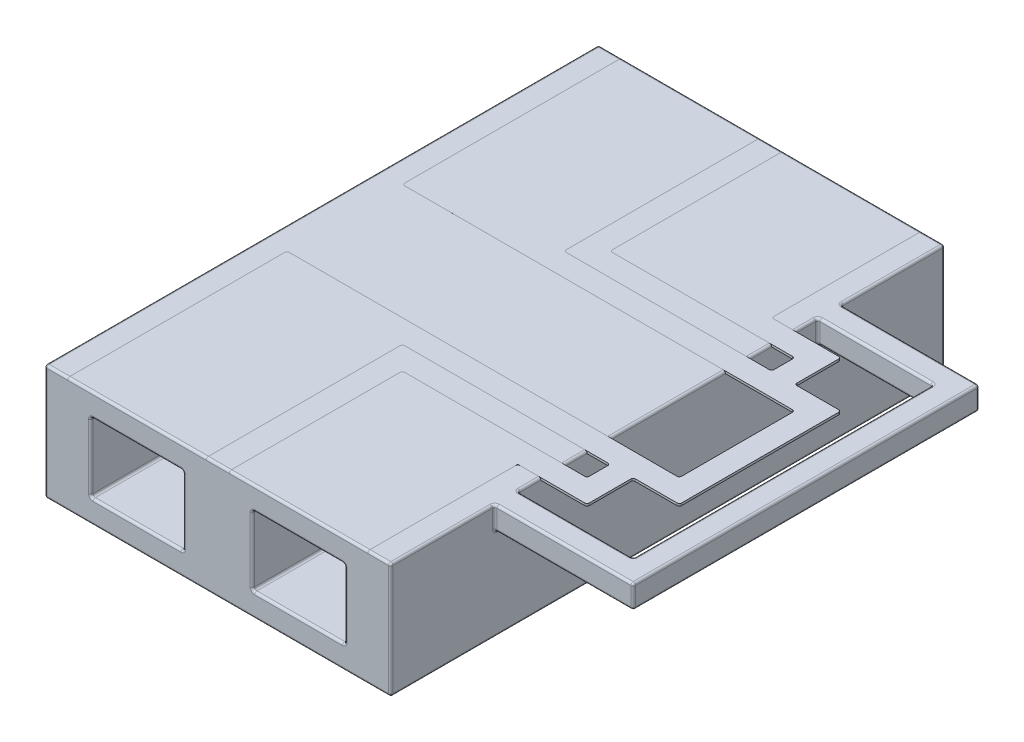
from build123d import *

# Parameters (mm, degrees)
SKETCH_SHROUD_SURFACES_W              = 5
SKETCH_SHROUD_SURFACES_H              = 13
SHROUD_SURFACES_DEPTH                 = 1
SKETCH_MOUNT_W                        = 15
SKETCH_MOUNT_H                        = 24
MOUNT_DEPTH                           = 4
BODY_FILLETS_R                        = 0.1
SPACE_FOR_CONDUCTIVE_TRACES_DEPTH     = 0.1
SPACE_FOR_CONDUCTIVE_TRACES_FILLETS_R = 0.1
CONDUCTIVE_TRACES_DEPTH               = 0.1
CONDUCTIVE_TRACES_FILLETS_R           = 0.1
ELECTRICAL_CONTACTS_FILLETS_R         = 0.1
CUT_EXTRUDE0_START                    = -1
SKETCH0_W                             = 4
SKETCH0_H                             = 5
CUT_EXTRUDE0_DEPTH                    = 3
FILLET0_R                             = 0.1


with BuildPart() as part:
    # Sketch: Shroud Surfaces → Shroud Surfaces (new body)
    with BuildSketch(Plane(origin=(0, 0, 0), x_dir=(1, 0, 0), z_dir=(0, 1, 0))):
        Polygon((15, 7.5), (21, 7.5), (21, -7.5), (15, -7.5), (15, -12), (0, -12), (0, 12), (15, 12), align=None)
        with Locations((17.5, 0)):
            Rectangle(SKETCH_SHROUD_SURFACES_W, SKETCH_SHROUD_SURFACES_H, mode=Mode.SUBTRACT)
    extrude(amount=-SHROUD_SURFACES_DEPTH)

    # Sketch: Mount → Mount (add)
    with BuildSketch(Plane.XZ.offset(1)):
        with Locations((7.5, 0)):
            Rectangle(SKETCH_MOUNT_W, SKETCH_MOUNT_H)
    extrude(amount=MOUNT_DEPTH)

    # Body Fillets
    body_fillets_edges = [part.edges().sort_by_distance(p)[0] for p in [
        (17.5, -1, 6.5),
        (15, 0, 9.75),
        (7.5, 0, 12),
        (0, 0, 0),
        (7.5, 0, -12),
        (15, 0, -9.75),
        (18, 0, -7.5),
        (21, 0, 0),
        (18, 0, 7.5),
        (17.5, 0, -6.5),
        (15, 0, 0),
        (17.5, 0, 6.5),
        (20, 0, 0),
        (17.5, -1, -6.5),
        (15, -0.5, 7.5),
        (15, -2.5, 12),
        (0, -2.5, 12),
        (0, -2.5, -12),
        (15, -2.5, -12),
        (15, -0.5, -7.5),
        (21, -0.5, -7.5),
        (21, -0.5, 7.5),
        (20, -0.5, -6.5),
        (15, -0.5, -6.5),
        (15, -0.5, 6.5),
        (20, -0.5, 6.5),
        (18, -1, 7.5),
        (21, -1, 0),
        (18, -1, -7.5),
        (15, -1, 7),
        (15, -1, -7),
        (0, -5, 0),
        (7.5, -5, -12),
        (15, -5, 0),
        (7.5, -5, 12),
        (20, -1, 0),
    ]]
    fillet(body_fillets_edges, radius=BODY_FILLETS_R)

    # Sketch: Conductive Traces → Space for Conductive Traces (cut)
    with BuildSketch(Plane(origin=(0, 0, 0), x_dir=(1, 0, 0), z_dir=(0, 1, 0))):
        Polygon((18, -2.5), (1, -2.5), (1, -12), (7, -12), (7, -3.5), (16, -3.5), (16, -4.5), (8, -4.5), (8, -12), (14, -12), (14, -5.5), (17, -5.5), (17, -3.5), (19, -3.5), (19, 3.5), (17, 3.5), (17, 5.5), (14, 5.5), (14, 12), (8, 12), (8, 4.5), (16, 4.5), (16, 3.5), (7, 3.5), (7, 12), (1, 12), (1, 2.5), (18, 2.5), align=None)
    extrude(amount=-SPACE_FOR_CONDUCTIVE_TRACES_DEPTH, mode=Mode.SUBTRACT)

    # Space for Conductive Traces Fillets
    space_for_conductive_traces_fillets_edges = [part.edges().sort_by_distance(p)[0] for p in [
        (7, -0.05, 3.5),
        (1, -0.05, 2.5),
        (1, -0.05, -2.5),
        (7, -0.05, -3.5),
        (8, -0.05, -4.5),
        (14, -0.05, -5.5),
        (14, -0.05, 5.5),
        (8, -0.05, 4.5),
    ]]
    fillet(space_for_conductive_traces_fillets_edges, radius=SPACE_FOR_CONDUCTIVE_TRACES_FILLETS_R)

    # Sketch0 → Cut-Extrude0 (cut)
    with BuildSketch(Plane(origin=(0, 0, 0), x_dir=(1, 0, 0), z_dir=(0, 1, 0)).offset(CUT_EXTRUDE0_START)):
        with Locations((4, 9.5)):
            Rectangle(SKETCH0_W, SKETCH0_H)
        with Locations((11, 9.5)):
            Rectangle(SKETCH0_W, SKETCH0_H)
        with Locations((11, -9.5)):
            Rectangle(SKETCH0_W, SKETCH0_H)
        with Locations((4, -9.5)):
            Rectangle(SKETCH0_W, SKETCH0_H)
    extrude(amount=-CUT_EXTRUDE0_DEPTH, mode=Mode.SUBTRACT)

    # Fillet0
    fillet0_edges = [part.edges().sort_by_distance(p)[0] for p in [
        (2, -4, 9.5),
        (2, -2.5, 12),
        (4, -4, 7),
        (2, -2.5, 7),
        (6, -4, 9.5),
        (6, -2.5, 7),
        (4, -4, 12),
        (6, -2.5, 12),
        (2, -1, 9.5),
        (4, -1, 12),
        (6, -1, 9.5),
        (4, -1, 7),
        (9, -4, 9.5),
        (9, -2.5, 12),
        (11, -4, 7),
        (9, -2.5, 7),
        (13, -4, 9.5),
        (13, -2.5, 7),
        (11, -4, 12),
        (13, -2.5, 12),
        (9, -1, 9.5),
        (11, -1, 12),
        (13, -1, 9.5),
        (11, -1, 7),
        (9, -4, -9.5),
        (9, -2.5, -7),
        (11, -4, -12),
        (9, -2.5, -12),
        (13, -4, -9.5),
        (13, -2.5, -12),
        (11, -4, -7),
        (13, -2.5, -7),
        (9, -1, -9.5),
        (11, -1, -7),
        (13, -1, -9.5),
        (11, -1, -12),
        (2, -4, -9.5),
        (2, -2.5, -7),
        (4, -4, -12),
        (2, -2.5, -12),
        (6, -4, -9.5),
        (6, -2.5, -12),
        (4, -4, -7),
        (6, -2.5, -7),
        (2, -1, -9.5),
        (4, -1, -7),
        (6, -1, -9.5),
        (4, -1, -12),
    ]]
    fillet(fillet0_edges, radius=FILLET0_R)


with BuildPart() as body_2:
    # Conductive Traces Sketch<5> → Conductive Traces (new body)
    with BuildSketch(Plane(origin=(0, 0, 0), x_dir=(1, 0, 0), z_dir=(0, 1, 0))):
        Polygon((18, -2.5), (1, -2.5), (1, -12), (7, -12), (7, -3.5), (16, -3.5), (16, -4.5), (8, -4.5), (8, -12), (14, -12), (14, -5.5), (17, -5.5), (17, -3.5), (19, -3.5), (19, 3.5), (17, 3.5), (17, 5.5), (14, 5.5), (14, 12), (8, 12), (8, 4.5), (16, 4.5), (16, 3.5), (7, 3.5), (7, 12), (1, 12), (1, 2.5), (18, 2.5), align=None)
    extrude(amount=-CONDUCTIVE_TRACES_DEPTH)

    # Conductive Traces Fillets
    conductive_traces_fillets_edges = [body_2.edges().sort_by_distance(p)[0] for p in [
        (7, -0.05, 3.5),
        (1, -0.05, 2.5),
        (18, -0.05, 2.5),
        (18, -0.05, -2.5),
        (1, -0.05, -2.5),
        (7, -0.05, -3.5),
        (16, -0.05, -3.5),
        (16, -0.05, -4.5),
        (8, -0.05, -4.5),
        (14, -0.05, -5.5),
        (17, -0.05, -5.5),
        (17, -0.05, -3.5),
        (19, -0.05, -3.5),
        (19, -0.05, 3.5),
        (17, -0.05, 3.5),
        (17, -0.05, 5.5),
        (8, -0.05, 4.5),
        (16, -0.05, 4.5),
        (16, -0.05, 3.5),
    ]]
    fillet(conductive_traces_fillets_edges, radius=CONDUCTIVE_TRACES_FILLETS_R)

    # Electrical Contacts Fillets
    electrical_contacts_fillets_edges = [body_2.edges().sort_by_distance(p)[0] for p in [
        (11, 0, -12),
        (4, 0, -12),
        (11, 0, 12),
        (4, 0, 12),
    ]]
    fillet(electrical_contacts_fillets_edges, radius=ELECTRICAL_CONTACTS_FILLETS_R - 0.0001)  # a hair under: the kernel refuses the full size


solid = Compound([part.part, body_2.part])
